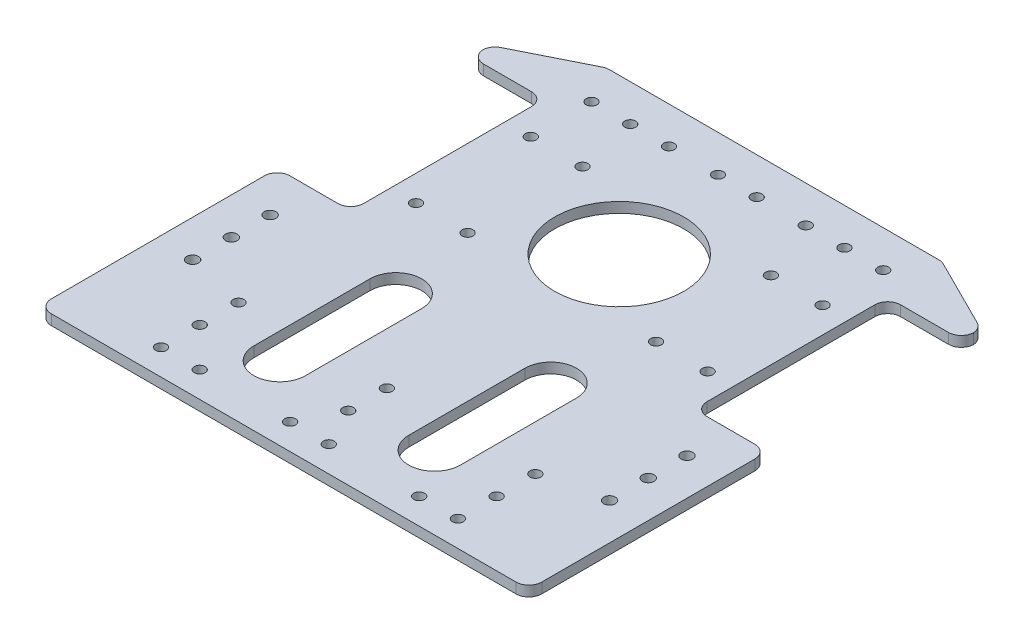
from build123d import *

# Parameters (mm, degrees)
SALIENTE_EXTRUIR1_DEPTH = 4
CROQUIS3_W              = 28.5
CROQUIS3_H              = 75
CORTAR_EXTRUIR1_DEPTH   = 135.40982107
CROQUIS4_R              = 2.25
CROQUIS4_R_2            = 2.1
CORTAR_EXTRUIR2_DEPTH   = 135.40982107
CROQUIS5_R              = 25
CORTAR_EXTRUIR3_DEPTH   = 135.40982107
REDONDEO1_R             = 5
CROQUIS6_R              = 2.1
CORTAR_EXTRUIR4_DEPTH   = 135.40982107
CROQUIS7_R              = 2.1
CORTAR_EXTRUIR5_DEPTH   = 135.40982107
CORTAR_EXTRUIR6_REACH   = 136.41
CROQUIS8_R              = 2.1
CROQUIS9_R              = 2.1
CORTAR_EXTRUIR7_DEPTH   = 135.40982107


with BuildPart() as part:
    # Croquis2 → Saliente-Extruir1 (new body)
    with BuildSketch(Plane(origin=(0, 0, 0), x_dir=(1, 0, 0), z_dir=(0, 1, 0))):
        Polygon((-65, 95), (-95, 80), (-95, -95), (95, -95), (95, 80), (65, 95), align=None)
    extrude(amount=SALIENTE_EXTRUIR1_DEPTH)

    # Croquis3 → Cortar-Extruir1 (cut, through all)
    with BuildSketch(Plane(origin=(0, 4, 0), x_dir=(1, 0, 0), z_dir=(0, 1, 0))):
        with Locations((-80.75, 35)):
            Rectangle(CROQUIS3_W, CROQUIS3_H)
        with Locations((80.75, 35)):
            Rectangle(CROQUIS3_W, CROQUIS3_H)
    extrude(amount=-CORTAR_EXTRUIR1_DEPTH, mode=Mode.SUBTRACT)

    # Croquis4 → Cortar-Extruir2 (cut, through all)
    with BuildSketch(Plane(origin=(0, 4, 0), x_dir=(1, 0, 0), z_dir=(0, 1, 0))):
        with Locations(Location((-80.75, -19.5, 0), (0, 0, 270))):
            Circle(CROQUIS4_R)
        with Locations(Location((-80.75, -34.5, 0), (0, 0, 270))):
            Circle(CROQUIS4_R)
        with Locations(Location((-80.75, -49.5, 0), (0, 0, 270))):
            Circle(CROQUIS4_R)
        with Locations(Location((-56.5, 80.75, 0), (0, 0, 270))):
            Circle(CROQUIS4_R_2)
        with Locations(Location((-41.5, 80.75, 0), (0, 0, 270))):
            Circle(CROQUIS4_R_2)
        with Locations(Location((-26.5, 80.75, 0), (0, 0, 270))):
            Circle(CROQUIS4_R_2)
        with Locations(Location((80.75, -49.5, 0), (0, 0, 90))):
            Circle(CROQUIS4_R)
        with Locations(Location((80.75, -34.5, 0), (0, 0, 90))):
            Circle(CROQUIS4_R)
        with Locations(Location((80.75, -19.5, 0), (0, 0, 90))):
            Circle(CROQUIS4_R)
        with Locations(Location((26.5, 80.75, 0), (0, 0, 90))):
            Circle(CROQUIS4_R_2)
        with Locations(Location((41.5, 80.75, 0), (0, 0, 90))):
            Circle(CROQUIS4_R_2)
        with Locations(Location((56.5, 80.75, 0), (0, 0, 90))):
            Circle(CROQUIS4_R_2)
    extrude(amount=-CORTAR_EXTRUIR2_DEPTH, mode=Mode.SUBTRACT)

    # Croquis5 → Cortar-Extruir3 (cut, through all)
    with BuildSketch(Plane(origin=(0, 4, 0), x_dir=(1, 0, 0), z_dir=(0, 1, 0))):
        with Locations(Location((0, 35, 0), (0, 0, 270))):
            Circle(CROQUIS5_R)
        with BuildLine():
            Line((-20, -21.536154127), (-20, -66.536154127))
            ThreePointArc((-20, -66.536154127), (-30, -76.536154127), (-40, -66.536154127))
            Line((-40, -66.536154127), (-40, -21.536154127))
            ThreePointArc((-40, -21.536154127), (-30, -11.536154127), (-20, -21.536154127))
        make_face()
        with BuildLine():
            Line((20, -21.536154127), (20, -66.536154127))
            ThreePointArc((20, -66.536154127), (30, -76.536154127), (40, -66.536154127))
            Line((40, -66.536154127), (40, -21.536154127))
            ThreePointArc((40, -21.536154127), (30, -11.536154127), (20, -21.536154127))
        make_face()
    extrude(amount=-CORTAR_EXTRUIR3_DEPTH, mode=Mode.SUBTRACT)

    # Redondeo1
    # the kernel refuses this fillet: 5 mm, written as the material it adds along each edge
    with BuildSketch(Plane(origin=(-66.5, 4, -72.5), x_dir=(-1, 0, 0), z_dir=(0, -1, 0)), Plane(origin=(-66.5, 4, 2.5), x_dir=(0, 0, -1), z_dir=(0, -1, 0))) as redondeo1_piece_1:
        with BuildLine():
            CenterArc((REDONDEO1_R, -REDONDEO1_R), REDONDEO1_R, 90, 90)
            Line((0, -REDONDEO1_R), (0, 0))
            Line((0, 0), (REDONDEO1_R, 0))
        make_face()
    extrude(amount=4)
    with BuildSketch(Plane(origin=(66.5, 4, -72.5), x_dir=(1, 0, 0), z_dir=(0, -1, 0)), Plane(origin=(66.5, 4, 2.5), x_dir=(0, 0, -1), z_dir=(0, -1, 0))) as redondeo1_piece_2:
        with BuildLine():
            CenterArc((REDONDEO1_R, REDONDEO1_R), REDONDEO1_R, 180, 90)
            Line((0, REDONDEO1_R), (0, 0))
            Line((0, 0), (REDONDEO1_R, 0))
        make_face()
    extrude(amount=4)
    # the kernel refuses this fillet: 5 mm, written as the material it takes off along each edge
    with BuildSketch(Plane(origin=(95, -12.5, 95), x_dir=(0, 0, -1), z_dir=(0, 1, 0)), Plane(origin=(-95, -12.5, 95), x_dir=(1, 0, 0), z_dir=(0, 1, 0)), Plane(origin=(-95, 16.5, -72.5), x_dir=(0, 0, -1), z_dir=(0, -1, 0))) as redondeo1_2_piece_1:
        with BuildLine():
            CenterArc((REDONDEO1_R, REDONDEO1_R), REDONDEO1_R, 180, 90)
            Line((0, REDONDEO1_R), (0, 0))
            Line((0, 0), (REDONDEO1_R, 0))
        make_face()
    extrude(amount=29, mode=Mode.SUBTRACT)
    with BuildSketch(Plane(origin=(-95, -7.725424859, -80), x_dir=(0.894427190999916, 0, -0.447213595499958), z_dir=(0, 1, 0))) as redondeo1_2_piece_2:
        with BuildLine():
            CenterArc((REDONDEO1_R * 0.61803398875, -REDONDEO1_R), REDONDEO1_R, 90, 63.434948823)
            Line((-REDONDEO1_R * 0.27639320225, -REDONDEO1_R * 0.5527864045), (0, 0))
            Line((0, 0), (REDONDEO1_R * 0.61803398875, 0))
        make_face()
    extrude(amount=19.450849719, mode=Mode.SUBTRACT)
    with BuildSketch(Plane(origin=(-65, -2.950849719, -95), x_dir=(1, 0, 0), z_dir=(0, 1, 0)), Plane(origin=(65, -2.950849719, -95), x_dir=(0.8944271909999183, 0, 0.44721359549995315), z_dir=(0, 1, 0))) as redondeo1_2_piece_3:
        with BuildLine():
            CenterArc((REDONDEO1_R * 0.2360679775, -REDONDEO1_R), REDONDEO1_R, 90, 26.565051177)
            Line((-REDONDEO1_R * 0.211145618, -REDONDEO1_R * 0.105572809), (0, 0))
            Line((0, 0), (REDONDEO1_R * 0.2360679775, 0))
        make_face()
    extrude(amount=9.901699437, mode=Mode.SUBTRACT)
    with BuildSketch(Plane(origin=(95, -7.725424859, -80), x_dir=(-0.894427190999915, 0, -0.4472135954999598), z_dir=(0, 1, 0))) as redondeo1_2_piece_4:
        with BuildLine():
            CenterArc((REDONDEO1_R * 0.61803398875, REDONDEO1_R), REDONDEO1_R, 206.565051177, 63.434948823)
            Line((-REDONDEO1_R * 0.27639320225, REDONDEO1_R * 0.5527864045), (0, 0))
            Line((0, 0), (REDONDEO1_R * 0.61803398875, 0))
        make_face()
    extrude(amount=19.450849719, mode=Mode.SUBTRACT)
    with BuildSketch(Plane(origin=(-95, 16.5, 2.5), x_dir=(0, 0, 1), z_dir=(0, -1, 0)), Plane(origin=(95, 16.5, -72.5), x_dir=(0, 0, -1), z_dir=(0, -1, 0)), Plane(origin=(95, 16.5, 2.5), x_dir=(-1, 0, 0), z_dir=(0, -1, 0))) as redondeo1_2_piece_5:
        with BuildLine():
            CenterArc((REDONDEO1_R, -REDONDEO1_R), REDONDEO1_R, 90, 90)
            Line((0, -REDONDEO1_R), (0, 0))
            Line((0, 0), (REDONDEO1_R, 0))
        make_face()
    extrude(amount=29, mode=Mode.SUBTRACT)

    # Croquis6 → Cortar-Extruir4 (cut, through all)
    with BuildSketch(Plane(origin=(0, 4, 0), x_dir=(1, 0, 0), z_dir=(0, 1, 0))):
        with Locations(Location((-57.5, -85, 0), (0, 0, 270))):
            Circle(CROQUIS6_R)
        with Locations(Location((-42.5, -85, 0), (0, 0, 270))):
            Circle(CROQUIS6_R)
        with Locations(Location((42.5, -85, 0), (0, 0, 90))):
            Circle(CROQUIS6_R)
        with Locations(Location((57.5, -85, 0), (0, 0, 90))):
            Circle(CROQUIS6_R)
        with Locations(Location((-7.5, -85, 0), (0, 0, 270))):
            Circle(CROQUIS6_R)
        with Locations(Location((7.5, -85, 0), (0, 0, 270))):
            Circle(CROQUIS6_R)
    extrude(amount=-CORTAR_EXTRUIR4_DEPTH, mode=Mode.SUBTRACT)

    # Croquis7 → Cortar-Extruir5 (cut, through all)
    with BuildSketch(Plane(origin=(0, 4, 0), x_dir=(1, 0, 0), z_dir=(0, 1, 0))):
        with Locations(Location((-57.5, -70, 0), (0, 0, 270))):
            Circle(CROQUIS7_R)
        with Locations(Location((-57.5, -55, 0), (0, 0, 270))):
            Circle(CROQUIS7_R)
        with Locations(Location((57.5, -55, 0), (0, 0, 90))):
            Circle(CROQUIS7_R)
        with Locations(Location((57.5, -70, 0), (0, 0, 90))):
            Circle(CROQUIS7_R)
        with Locations(Location((0, -70, 0), (0, 0, 270))):
            Circle(CROQUIS7_R)
        with Locations(Location((0, -55, 0), (0, 0, 270))):
            Circle(CROQUIS7_R)
    extrude(amount=-CORTAR_EXTRUIR5_DEPTH, mode=Mode.SUBTRACT)

    # Croquis8 → Cortar-Extruir6 (cut, up to next)
    with BuildSketch(Plane.XZ, mode=Mode.PRIVATE) as cortar_extruir6_sk1:
        with Locations(Location((56.5, -57.25, 0), (0, 0, 270))):
            Circle(CROQUIS8_R)
    cortar_extruir6_tool1 = extrude(cortar_extruir6_sk1.sketch, amount=-CORTAR_EXTRUIR6_REACH, mode=Mode.PRIVATE) & part.part
    # Croquis8 → Cortar-Extruir6 (cut, up to next)
    with BuildSketch(Plane.XZ, mode=Mode.PRIVATE) as cortar_extruir6_sk2:
        with Locations(Location((36.5, -57.25, 0), (0, 0, 270))):
            Circle(CROQUIS8_R)
    cortar_extruir6_tool2 = extrude(cortar_extruir6_sk2.sketch, amount=-CORTAR_EXTRUIR6_REACH, mode=Mode.PRIVATE) & part.part
    # Croquis8 → Cortar-Extruir6 (cut, up to next)
    with BuildSketch(Plane.XZ, mode=Mode.PRIVATE) as cortar_extruir6_sk3:
        with Locations(Location((56.5, -12.75, 0), (0, 0, 90))):
            Circle(CROQUIS8_R)
    cortar_extruir6_tool3 = extrude(cortar_extruir6_sk3.sketch, amount=-CORTAR_EXTRUIR6_REACH, mode=Mode.PRIVATE) & part.part
    # Croquis8 → Cortar-Extruir6 (cut, up to next)
    with BuildSketch(Plane.XZ, mode=Mode.PRIVATE) as cortar_extruir6_sk4:
        with Locations(Location((36.5, -12.75, 0), (0, 0, 90))):
            Circle(CROQUIS8_R)
    cortar_extruir6_tool4 = extrude(cortar_extruir6_sk4.sketch, amount=-CORTAR_EXTRUIR6_REACH, mode=Mode.PRIVATE) & part.part
    # Croquis8 → Cortar-Extruir6 (cut, up to next)
    with BuildSketch(Plane.XZ, mode=Mode.PRIVATE) as cortar_extruir6_sk5:
        with Locations(Location((-36.5, -12.75, 0), (0, 0, 270))):
            Circle(CROQUIS8_R)
    cortar_extruir6_tool5 = extrude(cortar_extruir6_sk5.sketch, amount=-CORTAR_EXTRUIR6_REACH, mode=Mode.PRIVATE) & part.part
    # Croquis8 → Cortar-Extruir6 (cut, up to next)
    with BuildSketch(Plane.XZ, mode=Mode.PRIVATE) as cortar_extruir6_sk6:
        with Locations(Location((-56.5, -12.75, 0), (0, 0, 270))):
            Circle(CROQUIS8_R)
    cortar_extruir6_tool6 = extrude(cortar_extruir6_sk6.sketch, amount=-CORTAR_EXTRUIR6_REACH, mode=Mode.PRIVATE) & part.part
    # Croquis8 → Cortar-Extruir6 (cut, up to next)
    with BuildSketch(Plane.XZ, mode=Mode.PRIVATE) as cortar_extruir6_sk7:
        with Locations(Location((-36.5, -57.25, 0), (0, 0, 90))):
            Circle(CROQUIS8_R)
    cortar_extruir6_tool7 = extrude(cortar_extruir6_sk7.sketch, amount=-CORTAR_EXTRUIR6_REACH, mode=Mode.PRIVATE) & part.part
    # Croquis8 → Cortar-Extruir6 (cut, up to next)
    with BuildSketch(Plane.XZ, mode=Mode.PRIVATE) as cortar_extruir6_sk8:
        with Locations(Location((-56.5, -57.25, 0), (0, 0, 90))):
            Circle(CROQUIS8_R)
    cortar_extruir6_tool8 = extrude(cortar_extruir6_sk8.sketch, amount=-CORTAR_EXTRUIR6_REACH, mode=Mode.PRIVATE) & part.part
    add(cortar_extruir6_tool1.solids().sort_by_distance((56.5, 0, -57.25))[0], mode=Mode.SUBTRACT)
    add(cortar_extruir6_tool2.solids().sort_by_distance((36.5, 0, -57.25))[0], mode=Mode.SUBTRACT)
    add(cortar_extruir6_tool3.solids().sort_by_distance((56.5, 0, -12.75))[0], mode=Mode.SUBTRACT)
    add(cortar_extruir6_tool4.solids().sort_by_distance((36.5, 0, -12.75))[0], mode=Mode.SUBTRACT)
    add(cortar_extruir6_tool5.solids().sort_by_distance((-36.5, 0, -12.75))[0], mode=Mode.SUBTRACT)
    add(cortar_extruir6_tool6.solids().sort_by_distance((-56.5, 0, -12.75))[0], mode=Mode.SUBTRACT)
    add(cortar_extruir6_tool7.solids().sort_by_distance((-36.5, 0, -57.25))[0], mode=Mode.SUBTRACT)
    add(cortar_extruir6_tool8.solids().sort_by_distance((-56.5, 0, -57.25))[0], mode=Mode.SUBTRACT)

    # Croquis9 → Cortar-Extruir7 (cut, through all)
    with BuildSketch(Plane(origin=(0, 4, 0), x_dir=(1, 0, 0), z_dir=(0, 1, 0))):
        with Locations(Location((-7.5, 80.75, 0), (0, 0, 270))):
            Circle(CROQUIS9_R)
        with Locations(Location((7.5, 80.75, 0), (0, 0, 270))):
            Circle(CROQUIS9_R)
    extrude(amount=-CORTAR_EXTRUIR7_DEPTH, mode=Mode.SUBTRACT)


solid = part.part
